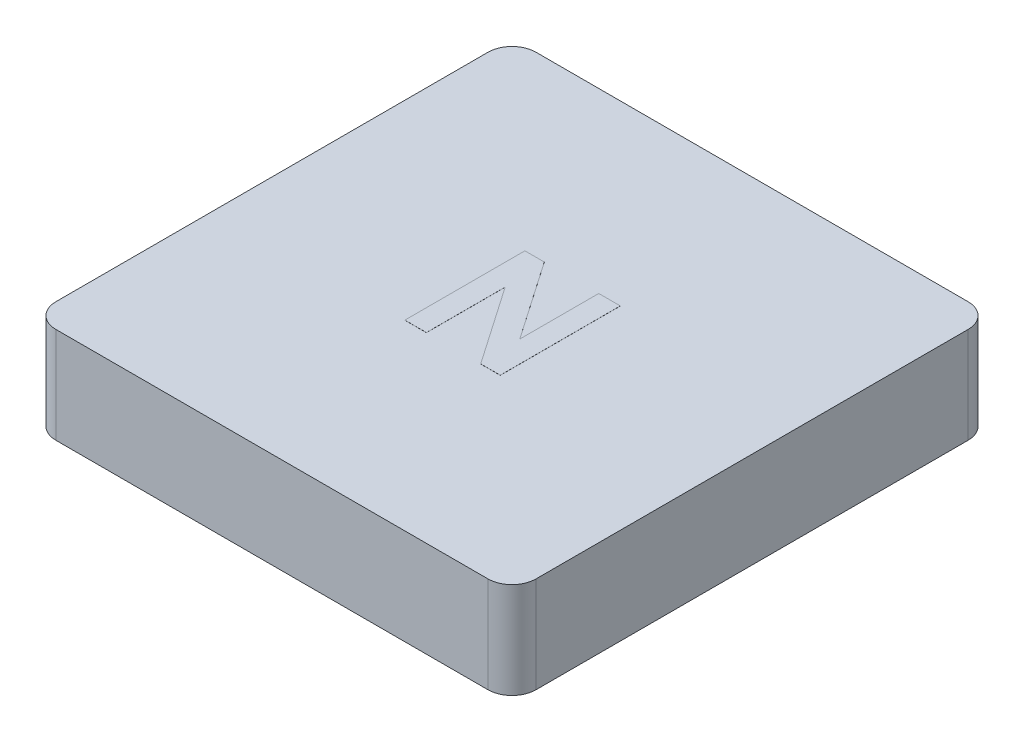
from build123d import *

# Parameters (mm, degrees)
SKETCH1_W           = 12.7
SKETCH1_H           = 12.7
BOSS_EXTRUDE1_DEPTH = 2.54
FILLET1_R           = 0.635
SHELL1_START        = 0.635
SHELL1_OUTLINE_W    = 1.905
SHELL1_OUTLINE_H    = 11.43
SHELL1_DEPTH        = 11.43
SKETCH2_R           = 2.54
BOSS_EXTRUDE2_DEPTH = 1.905
BOSS_EXTRUDE3_DEPTH = 0.00254


# Read off the part's stored shape, not the designer's step: Shell1
with BuildPart() as part:
    # Sketch1 → Boss-Extrude1 (new body)
    with BuildSketch(Plane(origin=(0, 0, 0), x_dir=(1, 0, 0), z_dir=(0, 1, 0))):
        with Locations((6.35, 6.35)):
            Rectangle(SKETCH1_W, SKETCH1_H)
    extrude(amount=BOSS_EXTRUDE1_DEPTH)

    # Fillet1
    fillet1_edges = [part.edges().sort_by_distance(p)[0] for p in [
        (0, 1.27, -12.7),
        (12.7, 1.27, -12.7),
        (12.7, 1.27, 0),
        (0, 1.27, 0),
    ]]
    fillet(fillet1_edges, radius=FILLET1_R)

    # Shell1 outline → Shell1 (cut)
    with BuildSketch(Plane.YZ.offset(SHELL1_START)):
        with Locations((0.9525, -6.35)):
            Rectangle(SHELL1_OUTLINE_W, SHELL1_OUTLINE_H)
    extrude(amount=SHELL1_DEPTH, mode=Mode.SUBTRACT)

    # Sketch2 → Boss-Extrude2 (add)
    with BuildSketch(Plane(origin=(0, 1.905, 0), x_dir=(-1, 0, 0), z_dir=(0, -1, 0))):
        with Locations(Location((-6.35, 6.35, 0), (0, 0, 270))):
            Circle(SKETCH2_R)
    extrude(amount=BOSS_EXTRUDE2_DEPTH)

    # Sketch3 → Boss-Extrude3 (add)
    with BuildSketch(Plane(origin=(0, 2.54, 0), x_dir=(1, 0, 0), z_dir=(0, 1, 0))):
        Polygon((5.039946154, 8.001), (5.55321238, 8.001), (6.993792308, 5.911682091), (6.993792308, 8.001), (7.563664103, 8.001), (7.563664103, 4.826), (7.046581771, 4.826), (5.609817949, 6.908957732), (5.609817949, 4.826), (5.039946154, 4.826), align=None)
    extrude(amount=BOSS_EXTRUDE3_DEPTH)


solid = part.part
